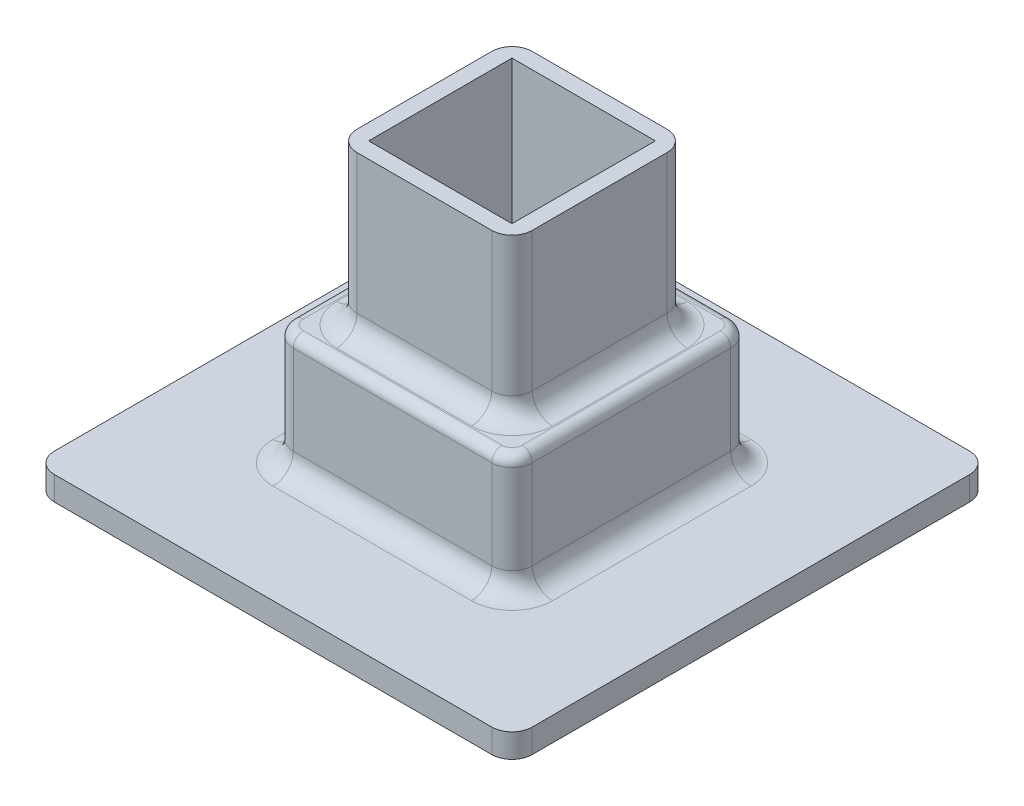
from build123d import *

# Parameters (mm, degrees)
SKETCH1_W           = 60
SKETCH1_H           = 60
BOSS_EXTRUDE1_DEPTH = 3
SKETCH2_W           = 30
SKETCH2_H           = 30
BOSS_EXTRUDE2_DEPTH = 14.999999878
SKETCH3_W           = 22
SKETCH3_H           = 22
BOSS_EXTRUDE3_DEPTH = 19.999999944
SHELL1_START        = -8
SHELL1_DEPTH        = 16
SHELL1_START_2      = -12
SHELL1_2_OUTLINE_W  = 14.999999878
SHELL1_2_OUTLINE_H  = 24
SHELL1_2_DEPTH      = 24
SKETCH4_W           = 16
SKETCH4_H           = 16
CUT_EXTRUDE1_DEPTH  = 55.999999887
SKETCH5_W           = 18
SKETCH5_H           = 18
SKETCH5_W_2         = 16
SKETCH5_H_2         = 16
CUT_EXTRUDE2_DEPTH  = 21.000000066
FILLET2_R           = 2.54
FILLET3_R           = 2.54
FILLET4_R           = 1.27


# Read off the part's stored shape, not the designer's step: Shell1
with BuildPart() as part:
    # Sketch1 → Boss-Extrude1 (new body)
    with BuildSketch(Plane(origin=(0, 0, 0), x_dir=(1, 0, 0), z_dir=(0, 1, 0))):
        Rectangle(SKETCH1_W, SKETCH1_H)
    extrude(amount=BOSS_EXTRUDE1_DEPTH)

    # Sketch2 → Boss-Extrude2 (add)
    with BuildSketch(Plane(origin=(0, 3, 0), x_dir=(1, 0, 0), z_dir=(0, 1, 0))):
        Rectangle(SKETCH2_W, SKETCH2_H)
    extrude(amount=BOSS_EXTRUDE2_DEPTH)

    # Sketch3 → Boss-Extrude3 (add)
    with BuildSketch(Plane(origin=(0, 17.999999878, 0), x_dir=(1, 0, 0), z_dir=(0, 1, 0))):
        Rectangle(SKETCH3_W, SKETCH3_H)
    extrude(amount=BOSS_EXTRUDE3_DEPTH)

    # Shell1 outline → Shell1 (cut)
    with BuildSketch(Plane.YZ.offset(SHELL1_START)):
        Polygon((14.999999878, 12), (0, 12), (0, -12), (14.999999878, -12), (14.999999878, -8), (34.999999822, -8), (34.999999822, 8), (14.999999878, 8), align=None)
    extrude(amount=SHELL1_DEPTH, mode=Mode.SUBTRACT)

    # Shell1 2 outline → Shell1 2 (cut)
    with BuildSketch(Plane.YZ.offset(SHELL1_START_2)):
        with Locations((7.499999939, 0)):
            Rectangle(SHELL1_2_OUTLINE_W, SHELL1_2_OUTLINE_H)
    extrude(amount=SHELL1_2_DEPTH, mode=Mode.SUBTRACT)

    # Sketch4 → Cut-Extrude1 (cut, through all)
    with BuildSketch(Plane.XZ.offset(-34.999999822)):
        Rectangle(SKETCH4_W, SKETCH4_H)
    extrude(amount=-CUT_EXTRUDE1_DEPTH, mode=Mode.SUBTRACT)

    # Sketch5 → Cut-Extrude2 (cut)
    with BuildSketch(Plane(origin=(0, 37.999999822, 0), x_dir=(1, 0, 0), z_dir=(0, 1, 0))):
        Rectangle(SKETCH5_W, SKETCH5_H)
        Rectangle(SKETCH5_W_2, SKETCH5_H_2, mode=Mode.SUBTRACT)
    extrude(amount=-CUT_EXTRUDE2_DEPTH, mode=Mode.SUBTRACT)

    # Fillet2
    fillet2_edges = [part.edges().sort_by_distance(p)[0] for p in [
        (-12, 0, 0),
        (-12, 7.499999939, -12),
        (0, 0, 12),
        (-12, 7.499999939, 12),
        (12, 0, 0),
        (12, 7.499999939, 12),
        (0, 0, -12),
        (12, 7.499999939, -12),
        (-12, 14.999999878, 0),
        (0, 14.999999878, 12),
        (12, 14.999999878, 0),
        (0, 14.999999878, -12),
    ]]
    fillet(fillet2_edges, radius=FILLET2_R)

    # Fillet3
    fillet3_edges = [part.edges().sort_by_distance(p)[0] for p in [
        (-15, 10.499999939, -15),
        (-15, 10.499999939, 15),
        (15, 10.499999939, 15),
        (15, 10.499999939, -15),
        (-11, 27.99999985, -11),
        (-11, 27.99999985, 11),
        (11, 27.99999985, 11),
        (11, 27.99999985, -11),
        (-30, 1.5, -30),
        (30, 1.5, -30),
        (30, 1.5, 30),
        (-30, 1.5, 30),
    ]]
    fillet(fillet3_edges, radius=FILLET3_R)
    fillet3_2_edges = [part.edges().sort_by_distance(p)[0] for p in [
        (-15, 3, 0),
        (0, 3, 15),
        (15, 3, 0),
        (0, 3, -15),
        (-11, 17.999999878, 0),
        (0, 17.999999878, 11),
        (11, 17.999999878, 0),
        (0, 17.999999878, -11),
        (10.256051224, 17.999999878, -10.256051224),
        (-10.256051224, 17.999999878, -10.256051224),
        (10.256051224, 17.999999878, 10.256051224),
        (-10.256051224, 17.999999878, 10.256051224),
        (-14.256051224, 3, -14.256051224),
        (14.256051224, 3, -14.256051224),
        (14.256051224, 3, 14.256051224),
        (-14.256051224, 3, 14.256051224),
    ]]
    fillet(fillet3_2_edges, radius=FILLET3_R)

    # Fillet4
    fillet4_edges = [part.edges().sort_by_distance(p)[0] for p in [
        (-15, 17.999999878, 0),
        (0, 17.999999878, 15),
        (15, 17.999999878, 0),
        (0, 17.999999878, -15),
        (-14.256051224, 17.999999878, -14.256051224),
        (-14.256051224, 17.999999878, 14.256051224),
        (14.256051224, 17.999999878, 14.256051224),
        (14.256051224, 17.999999878, -14.256051224),
    ]]
    fillet(fillet4_edges, radius=FILLET4_R)


solid = part.part
